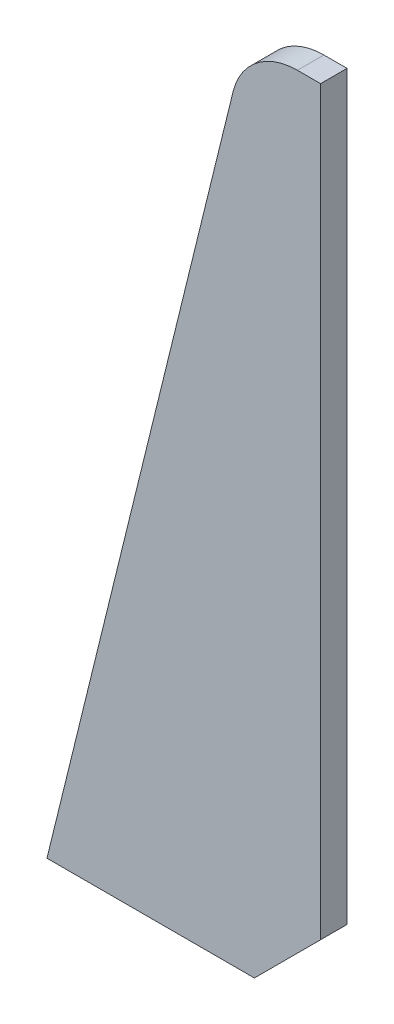
from build123d import *

# Parameters (mm, degrees)
SM_BASE_FLANGE_1_DEPTH   = 6
FILLET_1_R               = 15
CUT_EXTRUDE_1_DEPTH      = 200.020099487
CUT_EXTRUDE_1_DEPTH_BACK = 200.020099487
SKETCH_4_W               = 94.166763327
SKETCH_4_H               = 540.193326504
CHAMFER_1_SIZE           = 15


# Sheet-metal steps are written as plain solids
with BuildPart() as part:
    # Sketch 2 → Базовая кромка1 (new body)
    with BuildSketch(Plane.XY):
        Polygon((-62, 0), (78, 0), (33, 183), (-17, 183), align=None)
    extrude(amount=-SM_BASE_FLANGE_1_DEPTH)

    # Скругление1
    fillet_1_edges = [part.edges().sort_by_distance(p)[0] for p in [
        (-17, 183, -3),
        (33, 183, -3),
    ]]
    fillet(fillet_1_edges, radius=FILLET_1_R)

    # Эскиз4 → Вырез-Вытянуть1 (cut, two sides: drawn at the far end of the back side and taken through both)
    with BuildSketch(Plane.XY.offset(-CUT_EXTRUDE_1_DEPTH_BACK)):
        with Locations((47.083381664, 270.096663252)):
            Rectangle(SKETCH_4_W, SKETCH_4_H)
    extrude(amount=CUT_EXTRUDE_1_DEPTH + CUT_EXTRUDE_1_DEPTH_BACK, mode=Mode.SUBTRACT)

    # Фаска1
    chamfer_1_edges = [part.edges().sort_by_distance(p)[0] for p in [
        (0, 0, -3),
    ]]
    chamfer(chamfer_1_edges, length=CHAMFER_1_SIZE)


solid = part.part
